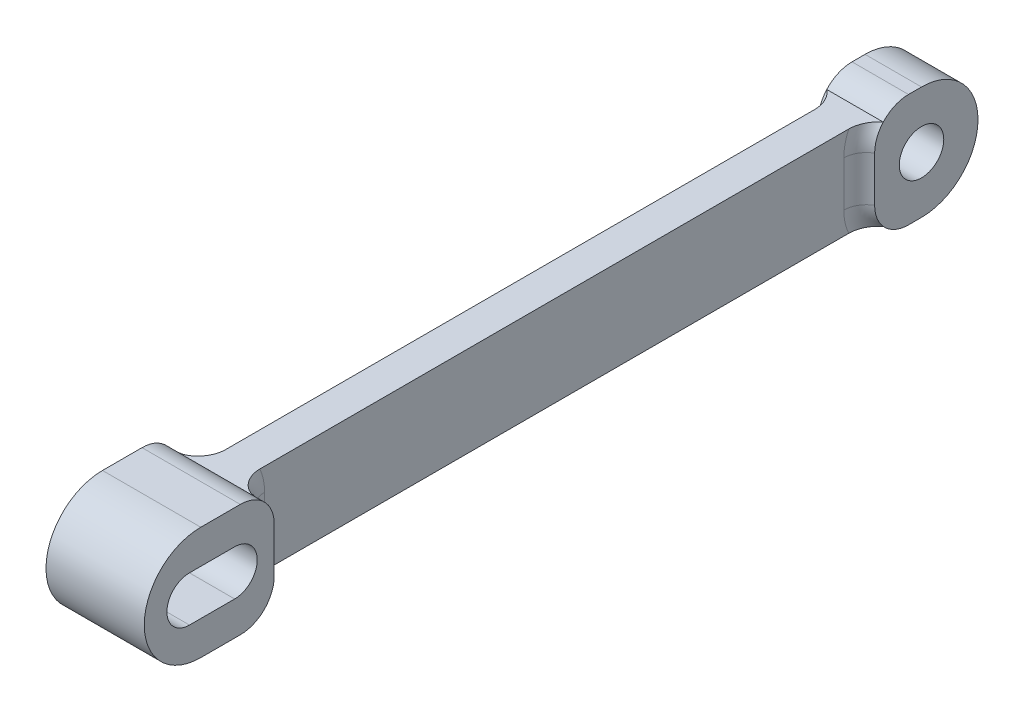
from build123d import *

# Parameters (mm, degrees)
SKETCH1_R           = 2.000000000000003
SKETCH1_R_2         = 1.969999999999999
BOSS_EXTRUDE1_DEPTH = 2.5
BOSS_EXTRUDE2_START = -2.5
BOSS_EXTRUDE2_DEPTH = 4.35
CUT_EXTRUDE1_DEPTH  = 8.7
SKETCH5_OUTSIDE_W   = 26.059999999999995
SKETCH5_OUTSIDE_H   = 27.360000000000003
CUT_EXTRUDE2_DEPTH  = 55
FILLET1_R           = 3
FILLET2_R           = 2
BOSS_EXTRUDE3_DEPTH = 1


with BuildPart() as part:
    # Sketch1 → Boss-Extrude1 (new, symmetric)
    with BuildSketch(Plane(origin=(0, 0, 0), x_dir=(0, 0, -1), z_dir=(1, 0, 0))):
        with BuildLine():
            Line((-32.325, 5.000000000000013), (32.325, 5.000000000000025))
            ThreePointArc((32.325, 5.000000000000025), (37.32499999999999, 0), (32.325, -4.999999999999987))
            Line((32.325, -4.999999999999987), (-32.325, -4.999999999999987))
            ThreePointArc((-32.325, -4.999999999999987), (-37.32500000000002, 6.1e-16), (-32.325, 5.000000000000013))
        make_face()
        with Locations((-32.325, 0)):
            Circle(SKETCH1_R, mode=Mode.SUBTRACT)
        with Locations((32.325, 0)):
            Circle(SKETCH1_R_2, mode=Mode.SUBTRACT)
    extrude(amount=BOSS_EXTRUDE1_DEPTH, both=True)

    # Sketch3 → Boss-Extrude2 (add, symmetric)
    # profile 1 of 2: a face of its own
    with BuildSketch(Plane(origin=(2.5, 0, 0), x_dir=(0, 0, -1), z_dir=(1, 0, 0)).offset(BOSS_EXTRUDE2_START)):
        with BuildLine():
            Line((-26.825000000000003, -4.999999999999987), (-26.825000000000003, 5.000000000000024))
            Line((-26.825000000000003, 5.000000000000024), (-32.325, 5.000000000000025))
            ThreePointArc((-32.325, 5.000000000000013), (-37.32500000000002, 1.341e-14), (-32.325, -4.999999999999987))
            Line((-32.325, -4.9999999999999885), (-26.825000000000003, -4.999999999999987))
        make_face()
        with BuildLine():
            ThreePointArc((-34.325, -2.000000000000003), (-36.325, -1.32e-15), (-34.325, 2.0000000000000004))
            Line((-34.325, 2.0000000000000013), (-30.325, 2.0000000000000027))
            ThreePointArc((-30.325, 2.0000000000000018), (-28.324999999999992, -3.2e-16), (-30.325, -2.0000000000000027))
            Line((-30.325, -2.0000000000000036), (-34.325, -2.000000000000004))
        make_face(mode=Mode.SUBTRACT)
    # profile 2 of 2: a face of its own
    with BuildSketch(Plane(origin=(2.5, 0, 0), x_dir=(0, 0, -1), z_dir=(1, 0, 0)).offset(BOSS_EXTRUDE2_START)):
        with BuildLine():
            ThreePointArc((-32.325, -4.999999999999987), (-37.32500000000002, 1.341e-14), (-32.325, 5.000000000000013))
            Line((-32.325, 5.000000000000025), (-33.325, 5.000000000000025))
            ThreePointArc((-33.325, 5.000000000000025), (-38.32500000000001, 1.829e-14), (-33.325, -4.999999999999989))
            Line((-33.325, -4.9999999999999885), (-32.325, -4.9999999999999885))
        make_face()
    extrude(amount=BOSS_EXTRUDE2_DEPTH, both=True)

    # Sketch4 → Cut-Extrude1 (cut)
    with BuildSketch(Plane(origin=(4.35, 0, 0), x_dir=(0, 0, -1), z_dir=(1, 0, 0))):
        with BuildLine():
            Line((-30.32500000000482, 2.000000000000003), (-34.32500000000001, 2.0000000000000013))
            ThreePointArc((-34.32500000000001, 2.0000000000000013), (-36.324999999999996, 1.195448e-11), (-34.32500000002392, -2.000000000000004))
            Line((-34.32500000002392, -2.000000000000004), (-30.32500000000482, -2.000000000000003))
            ThreePointArc((-30.32500000000482, -2.000000000000003), (-28.325000000004817, 0), (-30.32500000000482, 2.000000000000003))
        make_face()
    extrude(amount=-CUT_EXTRUDE1_DEPTH, mode=Mode.SUBTRACT)

    # Sketch5 outside → Cut-Extrude2 (cut)
    with BuildSketch(Plane(origin=(0, 0, 26.824999999973898), x_dir=(-1, 0, 0), z_dir=(0, 0, -1))):
        Rectangle(SKETCH5_OUTSIDE_W, SKETCH5_OUTSIDE_H)
        Polygon((1.5, 4.000000000000025), (-1.5, 4.000000000000025), (-1.4999999999999991, -4.000000000000006), (1.500000000000001, -4.000000000000006), align=None, mode=Mode.SUBTRACT)
    extrude(amount=CUT_EXTRUDE2_DEPTH, mode=Mode.SUBTRACT)

    # Fillet1
    # the kernel refuses this fillet: 3 mm, written as the material it takes off along each edge
    with BuildSketch(Plane(origin=(2.5, -4.999999999999987, 26.825000000000003), x_dir=(0, 1.0, -8.701780037275361e-12), z_dir=(-1, 0, 0))) as fillet1_piece_1_section:
        with BuildLine():
            CenterArc((FILLET1_R, -FILLET1_R), FILLET1_R, 89.99999999950143, 90.00000000000003)
            Line((-2.610534e-11, -FILLET1_R), (0, 0))
            Line((0, 0), (FILLET1_R, 0))
        make_face()
    fillet1_piece_1 = extrude(amount=14.349999999999998, mode=Mode.PRIVATE)
    fillet1_piece_1 = split(fillet1_piece_1, bisect_by=Plane(origin=(1.499999999999999, -4.999999999999987, 26.825000000000003), z_dir=(1, -1.1e-16, 0)), keep=Keep.TOP, mode=Mode.PRIVATE)
    fillet1_piece_1 = split(fillet1_piece_1, bisect_by=Plane(origin=(2.5, -4.000000000000006, 26.825000000000003), z_dir=(0, 1, 0)), keep=Keep.TOP, mode=Mode.PRIVATE)
    add(fillet1_piece_1, mode=Mode.SUBTRACT)
    with BuildSketch(Plane(origin=(2.5, -4.999999999999987, 26.825000000000003), x_dir=(0, 1.0, -8.701780037275361e-12), z_dir=(-1, 0, 0))) as fillet1_piece_2_section:
        with BuildLine():
            CenterArc((FILLET1_R, -FILLET1_R), FILLET1_R, 89.99999999950143, 90.00000000000003)
            Line((-2.610534e-11, -FILLET1_R), (0, 0))
            Line((0, 0), (FILLET1_R, 0))
        make_face()
    fillet1_piece_2 = extrude(amount=14.349999999999998, mode=Mode.PRIVATE)
    fillet1_piece_2 = split(fillet1_piece_2, bisect_by=Plane(origin=(1.4999999999999991, -4.999999999999987, 26.825000000000003), z_dir=(1, -1.1e-16, 0)), keep=Keep.TOP, mode=Mode.PRIVATE)
    fillet1_piece_2 = split(fillet1_piece_2, bisect_by=Plane(origin=(2.5, -4.000000000000006, 26.825000000000003), z_dir=(0, -1, 0)), keep=Keep.TOP, mode=Mode.PRIVATE)
    add(fillet1_piece_2, mode=Mode.SUBTRACT)
    with BuildSketch(Plane(origin=(2.5, -4.999999999999987, 26.825000000000003), x_dir=(0, 1.0, -8.701780037275361e-12), z_dir=(-1, 0, 0))) as fillet1_piece_3_section:
        with BuildLine():
            CenterArc((FILLET1_R, -FILLET1_R), FILLET1_R, 89.99999999950143, 90.00000000000003)
            Line((-2.610534e-11, -FILLET1_R), (0, 0))
            Line((0, 0), (FILLET1_R, 0))
        make_face()
    fillet1_piece_3 = extrude(amount=14.349999999999998, mode=Mode.PRIVATE)
    fillet1_piece_3 = split(fillet1_piece_3, bisect_by=Plane(origin=(1.4999999999999991, -4.999999999999987, 26.825000000000003), z_dir=(-1, 1.1e-16, 0)), keep=Keep.TOP, mode=Mode.PRIVATE)
    fillet1_piece_3 = split(fillet1_piece_3, bisect_by=Plane(origin=(-1.5000000000000009, -4.999999999999986, 26.825000000000003), z_dir=(1, -1.4e-16, 0)), keep=Keep.TOP, mode=Mode.PRIVATE)
    fillet1_piece_3 = split(fillet1_piece_3, bisect_by=Plane(origin=(2.5, -4.000000000000006, 26.825000000000003), z_dir=(0, -1, 0)), keep=Keep.TOP, mode=Mode.PRIVATE)
    add(fillet1_piece_3, mode=Mode.SUBTRACT)
    with BuildSketch(Plane(origin=(2.5, -4.999999999999987, 26.825000000000003), x_dir=(0, 1.0, -8.701780037275361e-12), z_dir=(-1, 0, 0))) as fillet1_piece_4_section:
        with BuildLine():
            CenterArc((FILLET1_R, -FILLET1_R), FILLET1_R, 89.99999999950143, 90.00000000000003)
            Line((-2.610534e-11, -FILLET1_R), (0, 0))
            Line((0, 0), (FILLET1_R, 0))
        make_face()
    fillet1_piece_4 = extrude(amount=14.349999999999998, mode=Mode.PRIVATE)
    fillet1_piece_4 = split(fillet1_piece_4, bisect_by=Plane(origin=(-1.5000000000000009, -4.999999999999986, 26.825000000000003), z_dir=(-1, 1.4e-16, 0)), keep=Keep.TOP, mode=Mode.PRIVATE)
    fillet1_piece_4 = split(fillet1_piece_4, bisect_by=Plane(origin=(2.5, -4.000000000000006, 26.825000000000003), z_dir=(0, 1, 0)), keep=Keep.TOP, mode=Mode.PRIVATE)
    add(fillet1_piece_4, mode=Mode.SUBTRACT)
    with BuildSketch(Plane(origin=(2.5, -4.999999999999987, 26.825000000000003), x_dir=(0, 1.0, -8.701780037275361e-12), z_dir=(-1, 0, 0))) as fillet1_piece_5_section:
        with BuildLine():
            CenterArc((FILLET1_R, -FILLET1_R), FILLET1_R, 89.99999999950143, 90.00000000000003)
            Line((-2.610534e-11, -FILLET1_R), (0, 0))
            Line((0, 0), (FILLET1_R, 0))
        make_face()
    fillet1_piece_5 = extrude(amount=14.349999999999998, mode=Mode.PRIVATE)
    fillet1_piece_5 = split(fillet1_piece_5, bisect_by=Plane(origin=(-1.5000000000000009, -4.999999999999986, 26.825000000000003), z_dir=(-1, 1.4e-16, 0)), keep=Keep.TOP, mode=Mode.PRIVATE)
    fillet1_piece_5 = split(fillet1_piece_5, bisect_by=Plane(origin=(2.5, -4.000000000000006, 26.825000000000003), z_dir=(0, -1, 0)), keep=Keep.TOP, mode=Mode.PRIVATE)
    add(fillet1_piece_5, mode=Mode.SUBTRACT)
    with BuildSketch(Plane(origin=(-2.5, 5.000000000000014, 26.824999999973898), x_dir=(0, -1, 0), z_dir=(1, 0, 0))) as fillet1_piece_6_section:
        with BuildLine():
            CenterArc((FILLET1_R, -FILLET1_R), FILLET1_R, 90, 90)
            Line((8.9e-16, -FILLET1_R), (0, 0))
            Line((0, 0), (FILLET1_R, 0))
        make_face()
    fillet1_piece_6 = extrude(amount=5, mode=Mode.PRIVATE)
    fillet1_piece_6 = split(fillet1_piece_6, bisect_by=Plane(origin=(-1.4999999999999998, 5.000000000000014, 26.824999999973898), z_dir=(-1, 1.4e-16, 0)), keep=Keep.TOP, mode=Mode.PRIVATE)
    fillet1_piece_6 = split(fillet1_piece_6, bisect_by=Plane(origin=(-2.5, 4.000000000000025, 26.824999999973898), z_dir=(0, -1, 0)), keep=Keep.TOP, mode=Mode.PRIVATE)
    add(fillet1_piece_6, mode=Mode.SUBTRACT)
    with BuildSketch(Plane(origin=(-2.5, 5.000000000000014, 26.824999999973898), x_dir=(0, -1, 0), z_dir=(1, 0, 0))) as fillet1_piece_7_section:
        with BuildLine():
            CenterArc((FILLET1_R, -FILLET1_R), FILLET1_R, 90, 90)
            Line((8.9e-16, -FILLET1_R), (0, 0))
            Line((0, 0), (FILLET1_R, 0))
        make_face()
    fillet1_piece_7 = extrude(amount=5, mode=Mode.PRIVATE)
    fillet1_piece_7 = split(fillet1_piece_7, bisect_by=Plane(origin=(-1.5, 5.000000000000014, 26.824999999973898), z_dir=(-1, 1.4e-16, 0)), keep=Keep.TOP, mode=Mode.PRIVATE)
    fillet1_piece_7 = split(fillet1_piece_7, bisect_by=Plane(origin=(-2.5, 4.000000000000025, 26.824999999973898), z_dir=(0, 1, 0)), keep=Keep.TOP, mode=Mode.PRIVATE)
    add(fillet1_piece_7, mode=Mode.SUBTRACT)
    with BuildSketch(Plane(origin=(-2.5, 5.000000000000014, 26.824999999973898), x_dir=(0, -1, 0), z_dir=(1, 0, 0))) as fillet1_piece_8_section:
        with BuildLine():
            CenterArc((FILLET1_R, -FILLET1_R), FILLET1_R, 90, 90)
            Line((8.9e-16, -FILLET1_R), (0, 0))
            Line((0, 0), (FILLET1_R, 0))
        make_face()
    fillet1_piece_8 = extrude(amount=5, mode=Mode.PRIVATE)
    fillet1_piece_8 = split(fillet1_piece_8, bisect_by=Plane(origin=(1.5, 5.000000000000014, 26.824999999973898), z_dir=(-1, 1.1e-16, 0)), keep=Keep.TOP, mode=Mode.PRIVATE)
    fillet1_piece_8 = split(fillet1_piece_8, bisect_by=Plane(origin=(-1.5, 5.000000000000014, 26.824999999973898), z_dir=(1, -1.4e-16, 0)), keep=Keep.TOP, mode=Mode.PRIVATE)
    fillet1_piece_8 = split(fillet1_piece_8, bisect_by=Plane(origin=(-2.5, 4.000000000000025, 26.824999999973898), z_dir=(0, 1, 0)), keep=Keep.TOP, mode=Mode.PRIVATE)
    add(fillet1_piece_8, mode=Mode.SUBTRACT)
    with BuildSketch(Plane(origin=(-2.5, 5.000000000000014, 26.824999999973898), x_dir=(0, -1, 0), z_dir=(1, 0, 0))) as fillet1_piece_9_section:
        with BuildLine():
            CenterArc((FILLET1_R, -FILLET1_R), FILLET1_R, 90, 90)
            Line((8.9e-16, -FILLET1_R), (0, 0))
            Line((0, 0), (FILLET1_R, 0))
        make_face()
    fillet1_piece_9 = extrude(amount=5, mode=Mode.PRIVATE)
    fillet1_piece_9 = split(fillet1_piece_9, bisect_by=Plane(origin=(1.5, 5.000000000000014, 26.824999999973898), z_dir=(1, -1.1e-16, 0)), keep=Keep.TOP, mode=Mode.PRIVATE)
    fillet1_piece_9 = split(fillet1_piece_9, bisect_by=Plane(origin=(-2.5, 4.000000000000025, 26.824999999973898), z_dir=(0, -1, 0)), keep=Keep.TOP, mode=Mode.PRIVATE)
    add(fillet1_piece_9, mode=Mode.SUBTRACT)
    with BuildSketch(Plane(origin=(-2.5, 5.000000000000014, 26.824999999973898), x_dir=(0, -1, 0), z_dir=(1, 0, 0))) as fillet1_piece_10_section:
        with BuildLine():
            CenterArc((FILLET1_R, -FILLET1_R), FILLET1_R, 90, 90)
            Line((8.9e-16, -FILLET1_R), (0, 0))
            Line((0, 0), (FILLET1_R, 0))
        make_face()
    fillet1_piece_10 = extrude(amount=5, mode=Mode.PRIVATE)
    fillet1_piece_10 = split(fillet1_piece_10, bisect_by=Plane(origin=(1.5, 5.000000000000014, 26.824999999973898), z_dir=(1, -1.1e-16, 0)), keep=Keep.TOP, mode=Mode.PRIVATE)
    fillet1_piece_10 = split(fillet1_piece_10, bisect_by=Plane(origin=(-2.5, 4.000000000000025, 26.824999999973898), z_dir=(0, 1, 0)), keep=Keep.TOP, mode=Mode.PRIVATE)
    add(fillet1_piece_10, mode=Mode.SUBTRACT)
    with BuildSketch(Plane(origin=(10, -4.999999999999987, -28.175000000026102), x_dir=(0, 0, -1), z_dir=(-1, 0, 0))) as fillet1_piece_11_section:
        with BuildLine():
            CenterArc((FILLET1_R, -FILLET1_R), FILLET1_R, 90, 90)
            Line((0, -FILLET1_R), (0, 0))
            Line((0, 0), (FILLET1_R, 0))
        make_face()
    fillet1_piece_11 = extrude(amount=20, mode=Mode.PRIVATE)
    fillet1_piece_11 = split(fillet1_piece_11, bisect_by=Plane(origin=(10, -4.000000000000006, -28.175000000026102), z_dir=(0, -1, 0)), keep=Keep.TOP, mode=Mode.PRIVATE)
    fillet1_piece_11 = split(fillet1_piece_11, bisect_by=Plane(origin=(1.5, -4.999999999999986, -28.175000000026102), z_dir=(1, -1.1e-16, 0)), keep=Keep.TOP, mode=Mode.PRIVATE)
    add(fillet1_piece_11, mode=Mode.SUBTRACT)
    with BuildSketch(Plane(origin=(10, -4.999999999999987, -28.175000000026102), x_dir=(0, 0, -1), z_dir=(-1, 0, 0))) as fillet1_piece_12_section:
        with BuildLine():
            CenterArc((FILLET1_R, -FILLET1_R), FILLET1_R, 90, 90)
            Line((0, -FILLET1_R), (0, 0))
            Line((0, 0), (FILLET1_R, 0))
        make_face()
    fillet1_piece_12 = extrude(amount=20, mode=Mode.PRIVATE)
    fillet1_piece_12 = split(fillet1_piece_12, bisect_by=Plane(origin=(10, -4.000000000000006, -28.175000000026102), z_dir=(0, 1, 0)), keep=Keep.TOP, mode=Mode.PRIVATE)
    fillet1_piece_12 = split(fillet1_piece_12, bisect_by=Plane(origin=(1.5, -4.999999999999986, -28.175000000026102), z_dir=(1, -1.1e-16, 0)), keep=Keep.TOP, mode=Mode.PRIVATE)
    add(fillet1_piece_12, mode=Mode.SUBTRACT)
    with BuildSketch(Plane(origin=(10, -4.999999999999987, -28.175000000026102), x_dir=(0, 0, -1), z_dir=(-1, 0, 0))) as fillet1_piece_13_section:
        with BuildLine():
            CenterArc((FILLET1_R, -FILLET1_R), FILLET1_R, 90, 90)
            Line((0, -FILLET1_R), (0, 0))
            Line((0, 0), (FILLET1_R, 0))
        make_face()
    fillet1_piece_13 = extrude(amount=20, mode=Mode.PRIVATE)
    fillet1_piece_13 = split(fillet1_piece_13, bisect_by=Plane(origin=(-1.5000000000000018, -4.999999999999985, -28.175000000026102), z_dir=(1, -1.4e-16, 0)), keep=Keep.TOP, mode=Mode.PRIVATE)
    fillet1_piece_13 = split(fillet1_piece_13, bisect_by=Plane(origin=(10, -4.000000000000006, -28.175000000026102), z_dir=(0, -1, 0)), keep=Keep.TOP, mode=Mode.PRIVATE)
    fillet1_piece_13 = split(fillet1_piece_13, bisect_by=Plane(origin=(1.5, -4.999999999999986, -28.175000000026102), z_dir=(-1, 1.1e-16, 0)), keep=Keep.TOP, mode=Mode.PRIVATE)
    add(fillet1_piece_13, mode=Mode.SUBTRACT)
    with BuildSketch(Plane(origin=(10, -4.999999999999987, -28.175000000026102), x_dir=(0, 0, -1), z_dir=(-1, 0, 0))) as fillet1_piece_14_section:
        with BuildLine():
            CenterArc((FILLET1_R, -FILLET1_R), FILLET1_R, 90, 90)
            Line((0, -FILLET1_R), (0, 0))
            Line((0, 0), (FILLET1_R, 0))
        make_face()
    fillet1_piece_14 = extrude(amount=20, mode=Mode.PRIVATE)
    fillet1_piece_14 = split(fillet1_piece_14, bisect_by=Plane(origin=(-1.5000000000000018, -4.999999999999985, -28.175000000026102), z_dir=(-1, 1.4e-16, 0)), keep=Keep.TOP, mode=Mode.PRIVATE)
    fillet1_piece_14 = split(fillet1_piece_14, bisect_by=Plane(origin=(10, -4.000000000000006, -28.175000000026102), z_dir=(0, -1, 0)), keep=Keep.TOP, mode=Mode.PRIVATE)
    add(fillet1_piece_14, mode=Mode.SUBTRACT)
    with BuildSketch(Plane(origin=(10, -4.999999999999987, -28.175000000026102), x_dir=(0, 0, -1), z_dir=(-1, 0, 0))) as fillet1_piece_15_section:
        with BuildLine():
            CenterArc((FILLET1_R, -FILLET1_R), FILLET1_R, 90, 90)
            Line((0, -FILLET1_R), (0, 0))
            Line((0, 0), (FILLET1_R, 0))
        make_face()
    fillet1_piece_15 = extrude(amount=20, mode=Mode.PRIVATE)
    fillet1_piece_15 = split(fillet1_piece_15, bisect_by=Plane(origin=(-1.5000000000000018, -4.999999999999985, -28.175000000026102), z_dir=(-1, 1.4e-16, 0)), keep=Keep.TOP, mode=Mode.PRIVATE)
    fillet1_piece_15 = split(fillet1_piece_15, bisect_by=Plane(origin=(10, -4.000000000000006, -28.175000000026102), z_dir=(0, 1, 0)), keep=Keep.TOP, mode=Mode.PRIVATE)
    add(fillet1_piece_15, mode=Mode.SUBTRACT)
    with BuildSketch(Plane(origin=(-10, 5.000000000000024, -28.175000000026102), x_dir=(0, 3e-16, -1), z_dir=(1, 0, 0))) as fillet1_piece_16_section:
        with BuildLine():
            CenterArc((FILLET1_R, -FILLET1_R), FILLET1_R, 89.99999999999999, 90.00000000000001)
            Line((-8.9e-16, -FILLET1_R), (0, 0))
            Line((0, 0), (FILLET1_R, 0))
        make_face()
    fillet1_piece_16 = extrude(amount=20, mode=Mode.PRIVATE)
    fillet1_piece_16 = split(fillet1_piece_16, bisect_by=Plane(origin=(-1.5, 5.000000000000023, -28.175000000026102), z_dir=(-1, 1.4e-16, 0)), keep=Keep.TOP, mode=Mode.PRIVATE)
    fillet1_piece_16 = split(fillet1_piece_16, bisect_by=Plane(origin=(-10, 4.000000000000025, -28.175000000026102), z_dir=(0, 1, 0)), keep=Keep.TOP, mode=Mode.PRIVATE)
    add(fillet1_piece_16, mode=Mode.SUBTRACT)
    with BuildSketch(Plane(origin=(-10, 5.000000000000024, -28.175000000026102), x_dir=(0, 3e-16, -1), z_dir=(1, 0, 0))) as fillet1_piece_17_section:
        with BuildLine():
            CenterArc((FILLET1_R, -FILLET1_R), FILLET1_R, 89.99999999999999, 90.00000000000001)
            Line((-8.9e-16, -FILLET1_R), (0, 0))
            Line((0, 0), (FILLET1_R, 0))
        make_face()
    fillet1_piece_17 = extrude(amount=20, mode=Mode.PRIVATE)
    fillet1_piece_17 = split(fillet1_piece_17, bisect_by=Plane(origin=(-1.5, 5.000000000000023, -28.175000000026102), z_dir=(-1, 1.4e-16, 0)), keep=Keep.TOP, mode=Mode.PRIVATE)
    fillet1_piece_17 = split(fillet1_piece_17, bisect_by=Plane(origin=(-10, 4.000000000000025, -28.175000000026102), z_dir=(0, -1, 0)), keep=Keep.TOP, mode=Mode.PRIVATE)
    add(fillet1_piece_17, mode=Mode.SUBTRACT)
    with BuildSketch(Plane(origin=(-10, 5.000000000000024, -28.175000000026102), x_dir=(0, 3e-16, -1), z_dir=(1, 0, 0))) as fillet1_piece_18_section:
        with BuildLine():
            CenterArc((FILLET1_R, -FILLET1_R), FILLET1_R, 89.99999999999999, 90.00000000000001)
            Line((-8.9e-16, -FILLET1_R), (0, 0))
            Line((0, 0), (FILLET1_R, 0))
        make_face()
    fillet1_piece_18 = extrude(amount=20, mode=Mode.PRIVATE)
    fillet1_piece_18 = split(fillet1_piece_18, bisect_by=Plane(origin=(-1.5, 5.000000000000023, -28.175000000026102), z_dir=(1, -1.4e-16, 0)), keep=Keep.TOP, mode=Mode.PRIVATE)
    fillet1_piece_18 = split(fillet1_piece_18, bisect_by=Plane(origin=(-10, 4.000000000000025, -28.175000000026102), z_dir=(0, 1, 0)), keep=Keep.TOP, mode=Mode.PRIVATE)
    fillet1_piece_18 = split(fillet1_piece_18, bisect_by=Plane(origin=(1.5, 5.000000000000023, -28.175000000026102), z_dir=(-1, 1.1e-16, 0)), keep=Keep.TOP, mode=Mode.PRIVATE)
    add(fillet1_piece_18, mode=Mode.SUBTRACT)
    with BuildSketch(Plane(origin=(-10, 5.000000000000024, -28.175000000026102), x_dir=(0, 3e-16, -1), z_dir=(1, 0, 0))) as fillet1_piece_19_section:
        with BuildLine():
            CenterArc((FILLET1_R, -FILLET1_R), FILLET1_R, 89.99999999999999, 90.00000000000001)
            Line((-8.9e-16, -FILLET1_R), (0, 0))
            Line((0, 0), (FILLET1_R, 0))
        make_face()
    fillet1_piece_19 = extrude(amount=20, mode=Mode.PRIVATE)
    fillet1_piece_19 = split(fillet1_piece_19, bisect_by=Plane(origin=(-10, 4.000000000000025, -28.175000000026102), z_dir=(0, 1, 0)), keep=Keep.TOP, mode=Mode.PRIVATE)
    fillet1_piece_19 = split(fillet1_piece_19, bisect_by=Plane(origin=(1.5, 5.000000000000023, -28.175000000026102), z_dir=(1, -1.1e-16, 0)), keep=Keep.TOP, mode=Mode.PRIVATE)
    add(fillet1_piece_19, mode=Mode.SUBTRACT)
    with BuildSketch(Plane(origin=(-10, 5.000000000000024, -28.175000000026102), x_dir=(0, 3e-16, -1), z_dir=(1, 0, 0))) as fillet1_piece_20_section:
        with BuildLine():
            CenterArc((FILLET1_R, -FILLET1_R), FILLET1_R, 89.99999999999999, 90.00000000000001)
            Line((-8.9e-16, -FILLET1_R), (0, 0))
            Line((0, 0), (FILLET1_R, 0))
        make_face()
    fillet1_piece_20 = extrude(amount=20, mode=Mode.PRIVATE)
    fillet1_piece_20 = split(fillet1_piece_20, bisect_by=Plane(origin=(-10, 4.000000000000025, -28.175000000026102), z_dir=(0, -1, 0)), keep=Keep.TOP, mode=Mode.PRIVATE)
    fillet1_piece_20 = split(fillet1_piece_20, bisect_by=Plane(origin=(1.5, 5.000000000000023, -28.175000000026102), z_dir=(1, -1.1e-16, 0)), keep=Keep.TOP, mode=Mode.PRIVATE)
    add(fillet1_piece_20, mode=Mode.SUBTRACT)
    with BuildSketch(Plane(origin=(-2.5, 5.000000000000024, 26.825000000000003), x_dir=(0, -1.0, -8.701780037275332e-12), z_dir=(-1, 0, 0))) as fillet1_piece_21:
        with BuildLine():
            CenterArc((FILLET1_R, FILLET1_R), FILLET1_R, 180.00000000049855, 90)
            Line((-2.609557e-11, FILLET1_R), (0, 0))
            Line((0, 0), (FILLET1_R, 0))
        make_face()
    extrude(amount=9.350000000000025, mode=Mode.SUBTRACT)
    with BuildSketch(Plane(origin=(11.850000000000026, 5.000000000000024, 26.825000000000003), x_dir=(0, -1.0, -8.701780037275332e-12), z_dir=(-1, 0, 0))) as fillet1_piece_22:
        with BuildLine():
            CenterArc((FILLET1_R, FILLET1_R), FILLET1_R, 180.00000000049855, 90)
            Line((-2.609557e-11, FILLET1_R), (0, 0))
            Line((0, 0), (FILLET1_R, 0))
        make_face()
    extrude(amount=9.350000000000026, mode=Mode.SUBTRACT)
    with BuildSketch(Plane(origin=(2.5, -4.999999999999987, 26.825000000000003), x_dir=(0, 1.0, -8.701780037275361e-12), z_dir=(1, 0, 0))) as fillet1_piece_23:
        with BuildLine():
            CenterArc((FILLET1_R, FILLET1_R), FILLET1_R, 180.00000000049855, 90)
            Line((-2.610534e-11, FILLET1_R), (0, 0))
            Line((0, 0), (FILLET1_R, 0))
        make_face()
    extrude(amount=9.35, mode=Mode.SUBTRACT)

    # Fillet2
    # the kernel refuses this fillet: 2 mm, written as the material it adds along each edge
    with BuildSketch(Plane(origin=(-1.5, 2, -31.175000000026), x_dir=(0, 0, 1), z_dir=(0, -1, 0))) as fillet2_piece_1_section:
        with BuildLine():
            CenterArc((4.7320508075689744, 2), FILLET2_R, 209.99999999999858, 60.00000000000142)
            Line((4.7320508075689744, 0), (3, 0))
            Line((3, 0), (3.000000000000071, 1.0000000000000417))
        make_face()
    fillet2_piece_1 = revolve(axis=Axis((-1.5, 2, -31.175000000026), (-1, 0, 0)), revolution_arc=124.5168172217792, mode=Mode.PRIVATE)
    fillet2_piece_1 = split(fillet2_piece_1, bisect_by=Plane(origin=(-1.5, 4, -31.175000000026), z_dir=(0, -1, 0)), keep=Keep.TOP, mode=Mode.PRIVATE)
    add(fillet2_piece_1)
    with BuildSketch(Plane(origin=(-1.5, -2, -31.175000000026), x_dir=(0, 1.5e-16, 1), z_dir=(0, 1, -1.5e-16))) as fillet2_piece_2_section:
        with BuildLine():
            CenterArc((4.7320508075689744, -2.000000000000001), FILLET2_R, 90, 60.00000000000142)
            Line((3.000000000000071, -1.0000000000000422), (3, 0))
            Line((3, 0), (4.7320508075689744, -8.9e-16))
        make_face()
    fillet2_piece_2 = revolve(axis=Axis((-1.5, -2, -31.175000000026), (1, 0, 0)), revolution_arc=124.51681722177923, mode=Mode.PRIVATE)
    fillet2_piece_2 = split(fillet2_piece_2, bisect_by=Plane(origin=(-1.5, -4, -31.175000000026), z_dir=(0, 1, 0)), keep=Keep.TOP, mode=Mode.PRIVATE)
    add(fillet2_piece_2)
    with BuildSketch(Plane(origin=(1.5, 2, -31.175000000026), x_dir=(0, -1.5e-16, 1), z_dir=(0, -1, -1.5e-16))) as fillet2_piece_3_section:
        with BuildLine():
            CenterArc((4.7320508075689744, -2), FILLET2_R, 90, 60.00000000000142)
            Line((4.7320508075689744, 0), (3, 0))
            Line((3, 0), (3.000000000000071, -1.0000000000000417))
        make_face()
    fillet2_piece_3 = revolve(axis=Axis((1.5, 2, -31.175000000026), (-1, 0, 0)), revolution_arc=124.51681722177923, mode=Mode.PRIVATE)
    fillet2_piece_3 = split(fillet2_piece_3, bisect_by=Plane(origin=(1.5, 4, -31.175000000026), z_dir=(0, -1, 0)), keep=Keep.TOP, mode=Mode.PRIVATE)
    add(fillet2_piece_3)
    with BuildSketch(Plane(origin=(1.5, -2, -31.175000000026), x_dir=(0, 0, 1), z_dir=(0, 1, 0))) as fillet2_piece_4_section:
        with BuildLine():
            CenterArc((4.7320508075689744, 2), FILLET2_R, 209.99999999999858, 60.00000000000142)
            Line((3.000000000000071, 1.0000000000000417), (3, 0))
            Line((3, 0), (4.7320508075689744, 0))
        make_face()
    fillet2_piece_4 = revolve(axis=Axis((1.5, -2, -31.175000000026), (1, 0, 0)), revolution_arc=124.5168172217792, mode=Mode.PRIVATE)
    fillet2_piece_4 = split(fillet2_piece_4, bisect_by=Plane(origin=(1.5, -4, -31.175000000026), z_dir=(0, 1, 0)), keep=Keep.TOP, mode=Mode.PRIVATE)
    add(fillet2_piece_4)
    with BuildSketch(Plane(origin=(1.5, 2, 29.824999999974), x_dir=(0, 0.6780114096841094, 0.7350513780261668), z_dir=(0, -0.7350513780261668, 0.6780114096841094))) as fillet2_piece_5_section:
        with BuildLine():
            CenterArc((3.0000000000000027 + FILLET2_R, -FILLET2_R), FILLET2_R, 90.00000000000007, 89.99999999999994)
            Line((3.0000000000000027 + FILLET2_R, 0), (3.0000000000000027, 0))
            Line((3.0000000000000027, 0), (3.0000000000000027, -FILLET2_R))
        make_face()
    fillet2_piece_5 = revolve(axis=Axis((1.5, 2, 29.824999999974), (-1, 0, 0)), revolution_arc=137.31155765907098, mode=Mode.PRIVATE)
    fillet2_piece_5 = split(fillet2_piece_5, bisect_by=Plane(origin=(1.5, 4, 29.824999999974), z_dir=(0, -1, 0)), keep=Keep.TOP, mode=Mode.PRIVATE)
    add(fillet2_piece_5)
    with BuildSketch(Plane(origin=(1.5, -1.9999999999729998, 29.824999999973), x_dir=(0, -4.645321164768272e-12, -1.0), z_dir=(0, 1.0, -4.645321164768272e-12))) as fillet2_piece_6_section:
        with BuildLine():
            CenterArc((3 + FILLET2_R, -FILLET2_R), FILLET2_R, 90.0000000000002, 89.99999999999977)
            Line((3 + FILLET2_R, 0), (3, 0))
            Line((3, 0), (3, -FILLET2_R))
        make_face()
    fillet2_piece_6 = revolve(axis=Axis((1.5, -1.9999999999729998, 29.824999999973), (-1, 0, 0)), revolution_arc=137.31155765949686, mode=Mode.PRIVATE)
    fillet2_piece_6 = split(fillet2_piece_6, bisect_by=Plane(origin=(1.5, -4, 29.824999999973), z_dir=(0, 1, 0)), keep=Keep.TOP, mode=Mode.PRIVATE)
    add(fillet2_piece_6)
    with BuildSketch(Plane(origin=(-1.5, -1.9999999999729998, 29.824999999973), x_dir=(0, -0.6780114096752294, 0.7350513780343578), z_dir=(0, 0.7350513780343578, 0.6780114096752294))) as fillet2_piece_7_section:
        with BuildLine():
            CenterArc((2.9999999999999987 + FILLET2_R, -FILLET2_R), FILLET2_R, 90, 89.99999999999997)
            Line((3.000000000000004, -FILLET2_R), (2.9999999999999987, 0))
            Line((2.9999999999999987, 0), (2.9999999999999987 + FILLET2_R, -8.9e-16))
        make_face()
    fillet2_piece_7 = revolve(axis=Axis((-1.5, -1.9999999999729998, 29.824999999973), (1, 0, 0)), revolution_arc=137.31155765974663, mode=Mode.PRIVATE)
    fillet2_piece_7 = split(fillet2_piece_7, bisect_by=Plane(origin=(-1.5, -4, 29.824999999973), z_dir=(0, 1, 0)), keep=Keep.TOP, mode=Mode.PRIVATE)
    add(fillet2_piece_7)
    with BuildSketch(Plane(origin=(-1.5000000000000009, -2, -28.175000000026102), x_dir=(-1, 1.4e-16, 7.461e-14), z_dir=(1.4e-16, 1, 0))) as fillet2_piece_8:
        with BuildLine():
            CenterArc((2.0000000000001292, 1.7320508075688252), FILLET2_R, 179.99999999999574, 60.000000000001364)
            Line((1.2945e-13, 1.7320508075689744), (0, 0))
            Line((0, 0), (1.0000000000000417, 0))
        make_face()
    extrude(amount=4)
    with BuildSketch(Plane(origin=(1.4999999999999998, 2, -28.175000000026102), x_dir=(2.6e-16, 0, 1), z_dir=(-1.1e-16, -1, 0))) as fillet2_piece_9:
        with BuildLine():
            CenterArc((1.732050807568975, -1.9999999999999996), FILLET2_R, 90.00000000000001, 60.00000000000141)
            Line((7.131e-14, -1.000000000000042), (0, 0))
            Line((0, 0), (1.7320508075689744, 0))
        make_face()
    extrude(amount=4)
    with BuildSketch(Plane(origin=(1.4999999999999998, 2, 26.824999999973898), x_dir=(1, -1.1e-16, 0), z_dir=(-1.1e-16, -1, 0))) as fillet2_piece_10:
        with BuildLine():
            CenterArc((FILLET2_R, -FILLET2_R), FILLET2_R, 90, 89.99999999999989)
            Line((-4.4e-16, -FILLET2_R), (0, 0))
            Line((0, 0), (FILLET2_R, 0))
        make_face()
    extrude(amount=3.999999999986936)
    with BuildSketch(Plane(origin=(-1.5, 2, 29.824999999974), x_dir=(0, 0, -1), z_dir=(0, -1, 0))) as fillet2_piece_11_section:
        with BuildLine():
            CenterArc((3 + FILLET2_R, -FILLET2_R), FILLET2_R, 90, 90)
            Line((3, -FILLET2_R), (3, 0))
            Line((3, 0), (3 + FILLET2_R, 0))
        make_face()
    fillet2_piece_11 = revolve(axis=Axis((-1.5, 2, 29.824999999974), (1, 0, 0)), revolution_arc=137.311557659071, mode=Mode.PRIVATE)
    fillet2_piece_11 = split(fillet2_piece_11, bisect_by=Plane(origin=(-1.5, 4, 29.824999999974), z_dir=(0, -1, 0)), keep=Keep.TOP, mode=Mode.PRIVATE)
    add(fillet2_piece_11)
    with BuildSketch(Plane(origin=(-1.5000000000000009, -1.9999999999869358, 26.824999999973898), x_dir=(0, 0, -1), z_dir=(1.4e-16, 1, 0))) as fillet2_piece_12:
        with BuildLine():
            CenterArc((FILLET2_R, FILLET2_R), FILLET2_R, 180, 90)
            Line((0, FILLET2_R), (0, 0))
            Line((0, 0), (FILLET2_R, 0))
        make_face()
    extrude(amount=3.999999999986936)

    # Sketch7 → Boss-Extrude3 (add)
    # profile 1 of 2: a face of its own
    with BuildSketch(Plane.ZY.offset(1.5000000000000007)):
        Polygon((16.157951236976444, 2.3637668719493634), (17.136358355032, 2.3637668719493634), (17.136358355032, -2.9278997947173035), (16.66146519263884, -2.9278997947173035), (16.66146519263884, 1.8210318292143204), (15.847362628536276, 1.8210318292143204), align=None)
    # profile 2 of 2: a face of its own
    with BuildSketch(Plane.ZY.offset(1.5000000000000007)):
        with BuildLine():
            Line((21.546080577254227, 2.499450632633124), (21.911790713472172, 2.2121826705604746))
            Line((21.911790713472172, 2.2121826705604746), (20.51361196080123, 0.07410341041090172))
            add(Edge.make_bspline(
                [(20.51361196080123, 0.07410341041090172), (20.606700355764126, 0.0889410330657405), (20.788279795294383, 0.11788349368825955), (20.972075856158632, 0.12265800644957006), (21.061647150437985, 0.12498482066731174)],
                knots=[0, 0, 0, 0, 1.0253186726835635, 2, 2, 2, 2], degree=3))
            add(Edge.make_bspline(
                [(21.061647150437985, 0.12498482066731174), (21.115429377039955, 0.123539270841559), (21.22129808963407, 0.12069374902678383), (21.376732183397134, 0.09879554619506938), (21.52609164611848, 0.06428615078674221), (21.668757417028452, 0.01398166857933296), (21.805241568173276, -0.0502778433731737), (21.936327333718317, -0.12729256391629246), (22.05955061090271, -0.22103924731281877), (22.17649822709214, -0.32576126379556675), (22.282674910055288, -0.4417500379727544), (22.376679184529163, -0.5648211065640464), (22.45564111965098, -0.6948462480732165), (22.51970645352065, -0.831759604900986), (22.569455496162682, -0.9753501282841829), (22.605722530930993, -1.1254341010821247), (22.627160724837186, -1.2821150162658774), (22.630071883418335, -1.388671305061177), (22.631550662724308, -1.4427986328583293)],
                knots=[0, 0, 0, 0, 1.0436928598724606, 2.0544783360515617, 3.04107314554365, 4.01509385229248, 4.984733325634288, 5.9658048345092585, 6.960378781699815, 7.985147595312681, 9.0094572007946, 10.008161701286003, 10.986880574874395, 11.956520048216204, 12.937015923455347, 13.931873656255771, 14.949455224094597, 16, 16, 16, 16], degree=3))
            add(Edge.make_bspline(
                [(22.631550662724308, -1.4427986328583293), (22.629399063673183, -1.5168512804922158), (22.625165225932662, -1.66256936591987), (22.582977343853795, -1.8748055767933303), (22.51742169047371, -2.076996403849277), (22.423717570149908, -2.265913698656237), (22.30732753873402, -2.441298535994553), (22.165393559343443, -2.5967003706202205), (22.002949237695493, -2.7352967365645027), (21.8192727690186, -2.8511942441764884), (21.621601858985542, -2.945844095111948), (21.413938720037677, -3.0138272587372508), (21.198300058310565, -3.0556820279354437), (21.051940710418553, -3.060929248634767), (20.977904829390976, -3.063583555401064)],
                knots=[0, 0, 0, 0, 1.031375317729535, 2.029502542568287, 3.0047892862325973, 3.9874768336660242, 4.960371454990566, 5.930067400454268, 6.912260824639644, 7.929083631048073, 8.949397510964918, 9.960523115702676, 10.968330549848183, 12, 12, 12, 12], degree=3))
            add(Edge.make_bspline(
                [(20.977904829390976, -3.063583555401064), (20.906699103404303, -3.061273053859959), (20.76565302736918, -3.0566963548441115), (20.55817011227199, -3.0159264249626108), (20.35880578843443, -2.949845448157503), (20.168956843490307, -2.8588071936938357), (19.993091154896906, -2.743814918277656), (19.835753823623865, -2.6053814724472213), (19.697729354945995, -2.446465971682956), (19.58286296377694, -2.267093065688531), (19.491757499999597, -2.074340391842578), (19.42343463702615, -1.873352072063133), (19.3835260311826, -1.6648604330252876), (19.3779492845232, -1.5235258535409533), (19.375140406314053, -1.4523388972814062)],
                knots=[0, 0, 0, 0, 1.0120166639115213, 2.004627820992881, 2.994792926891583, 3.992885781622149, 4.990978636352722, 5.97393611447994, 6.9644710632966165, 7.975201452678033, 8.993600317351408, 9.990122807281686, 10.98767138001809, 12, 12, 12, 12], degree=3))
            add(Edge.make_bspline(
                [(19.375140406314053, -1.4523388972814062), (19.376926638645397, -1.3978429202855351), (19.380573783776626, -1.2865725476224046), (19.40603938583578, -1.1180495529934997), (19.44695877794864, -0.9456151794306517), (19.49278498374342, -0.7993320533982958), (19.541204656073496, -0.6794961809117696), (19.581500757592828, -0.5828801891346449), (19.631656680177873, -0.4834557093631103), (19.685137863651306, -0.37781342639280807), (19.74675836784336, -0.26867592697086945), (19.813759409180488, -0.15421918861856818), (19.887993405192432, -0.03626351227253752), (19.94003341315372, 0.04378306863643511), (19.96663680054482, 0.08470370421432032)],
                knots=[0, 0, 0, 0, 1.1738182753765714, 2.3967126408219177, 3.663316289735292, 4.989737886459511, 5.693666773722722, 6.44728655731318, 7.243889046715883, 8.091586357081512, 8.99801382379476, 9.94318172108522, 10.948533337893382, 12, 12, 12, 12], degree=3))
            Line((19.96663680054482, 0.08470370421432032), (21.546080577254227, 2.499450632633124))
        make_face()
        with BuildLine():
            add(Edge.make_bspline(
                [(20.96200438868585, -0.41775022206773066), (20.921693613761555, -0.4189265500164105), (20.842954960256286, -0.42122426021755677), (20.72743422609448, -0.4345672006279394), (20.61810347688182, -0.4596936450179405), (20.51351423910048, -0.4916951231042067), (20.415621878754287, -0.5356961776742877), (20.323714942316997, -0.5891447308564679), (20.237438018629355, -0.6520719882925754), (20.157694791610297, -0.7235864610324709), (20.085396014878132, -0.8018850347154258), (20.02313406716811, -0.8857496694338908), (19.96942758131341, -0.9731592384153386), (19.92576102181219, -1.064844079593937), (19.891758169166348, -1.1607691444494896), (19.867162123208207, -1.2604932476815136), (19.853473713623988, -1.36468511527711), (19.851196435038403, -1.4353402086895508), (19.850033568707218, -1.47141942612756)],
                knots=[0, 0, 0, 0, 1.1295886309374756, 2.2064147360579205, 3.25113916495572, 4.268635594404192, 5.265702195542765, 6.250456723757759, 7.242448910951709, 8.251968644805965, 9.246821452807266, 10.222880185895152, 11.173611482269147, 12.116736599108348, 13.062300277602443, 14.02027055382606, 14.989073742497347, 15.999999999999998, 15.999999999999998, 15.999999999999998, 15.999999999999998], degree=3))
            add(Edge.make_bspline(
                [(19.850033568707218, -1.47141942612756), (19.850980567612073, -1.5071759433316256), (19.8528374914835, -1.5772891504482793), (19.869698736999126, -1.6806114814639046), (19.895454159083737, -1.7800417596439542), (19.933766424254287, -1.8750673911388518), (19.97946660040832, -1.9671368243544496), (20.039799650075093, -2.052915172627311), (20.10665121913047, -2.1376121833635655), (20.18656133279562, -2.2147215508778206), (20.272321655394297, -2.2864714469531533), (20.363944902040107, -2.3491856397716337), (20.459436746109652, -2.4028373543141464), (20.560086396151803, -2.444885085235777), (20.664465857626762, -2.4793932332070607), (20.77344479052967, -2.5036766601806675), (20.88709898877291, -2.5174055506744004), (20.96408810935335, -2.5196857957709335), (21.00334553451918, -2.5208485126660216)],
                knots=[0, 0, 0, 0, 0.9894672477425451, 1.9401979695111424, 2.891935181845065, 3.8276944291536847, 4.772920940615442, 5.730924761853561, 6.725747692481074, 7.756678648226949, 8.799015740266986, 9.819492440646854, 10.82689131599412, 11.82646672717308, 12.835195251845644, 13.867842841860803, 14.912794438403925, 15.999999999999998, 15.999999999999998, 15.999999999999998, 15.999999999999998], degree=3))
            add(Edge.make_bspline(
                [(21.00334553451918, -2.5208485126660216), (21.042602895370948, -2.519685704606356), (21.1195918898228, -2.5174052807237572), (21.233247002314076, -2.5036776861679217), (21.342222555488163, -2.4793894684608206), (21.446614300625587, -2.4448987324643916), (21.547218607118054, -2.40278672749183), (21.642626936068037, -2.3495194202670064), (21.733383696547264, -2.286085766047666), (21.81920031729136, -2.2148441662308676), (21.898777819304076, -2.1371733067314582), (21.967232752836868, -2.0536712263956267), (22.02571811738, -1.966443551317582), (22.07324361449452, -1.8754300749494677), (22.111133900176963, -1.7799843019768493), (22.13701992795373, -1.6806268741470498), (22.153846352874744, -1.5772851206049552), (22.15570806135761, -1.507174582289429), (22.156657500331146, -1.47141942612756)],
                knots=[0, 0, 0, 0, 1.0873979439112735, 2.1325344458803297, 3.16536476411286, 4.1742717844958035, 5.1740240717308135, 6.181601207505405, 7.19420369682742, 8.236725231653715, 9.267838611856464, 10.269026844132599, 11.221737036576933, 12.171628255771504, 13.107553086790192, 14.059458710154077, 15.010357664852927, 15.999999999999998, 15.999999999999998, 15.999999999999998, 15.999999999999998], degree=3))
            add(Edge.make_bspline(
                [(22.156657500331146, -1.47141942612756), (22.155825509731574, -1.4352931408121794), (22.154192582762626, -1.3643889916431897), (22.135723231930903, -1.2605398545482316), (22.1101079762137, -1.1602624594274296), (22.07142887025971, -1.0641870364842523), (22.02117837999743, -0.9726927179180591), (21.959971324129526, -0.8853173212943157), (21.889164938064933, -0.8013909628713809), (21.807374610346606, -0.7234329073518976), (21.71833818520638, -0.6521510157087913), (21.62366938351162, -0.5892262102022334), (21.5246275661342, -0.5361205907125698), (21.421313153154554, -0.49181104323795066), (21.312542366291154, -0.45983505258663016), (21.20007125823635, -0.43465693509047754), (21.082461331857758, -0.4212584082907129), (21.002668126428183, -0.41893451216148664), (20.96200438868585, -0.41775022206773066)],
                knots=[0, 0, 0, 0, 0.9782066386499336, 1.9199015016194259, 2.8516051441218906, 3.7801027241903635, 4.718870031278552, 5.67545198095606, 6.667674622786599, 7.690630535533242, 8.733308323373869, 9.756129686818632, 10.767539655587523, 11.776269906682614, 12.797430371072496, 13.836405706649092, 14.897401972361097, 16, 16, 16, 16], degree=3))
        make_face(mode=Mode.SUBTRACT)
    extrude(amount=BOSS_EXTRUDE3_DEPTH)


solid = part.part
